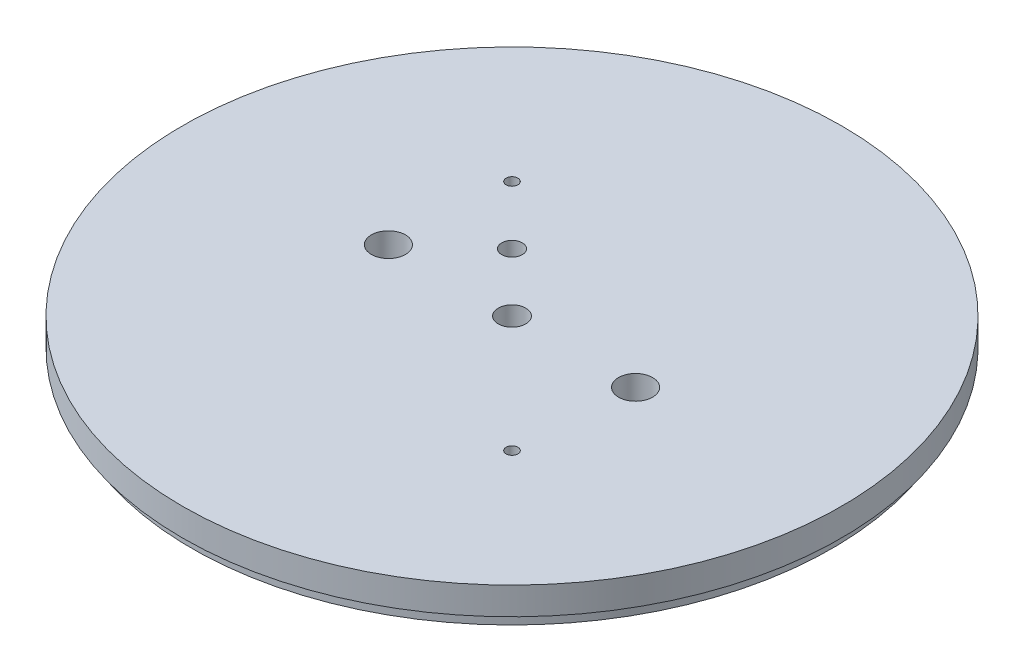
from build123d import *

# Parameters (mm, degrees)
SKETCH1_R           = 76.2
SKETCH1_R_2         = 3.175
SKETCH1_R_3         = 3.937
SKETCH1_R_4         = 1.3589
SKETCH1_R_5         = 2.38125
BOSS_EXTRUDE1_DEPTH = 9.525
SKETCH2_R           = 76.2
SKETCH2_R_2         = 74.041
CUT_EXTRUDE1_DEPTH  = 3.175
CUT_EXTRUDE2_START  = -5.969
CUT_EXTRUDE2_DEPTH  = 3.556


with BuildPart() as part:
    # Sketch1 → Boss-Extrude1 (new body)
    with BuildSketch(Plane(origin=(0, 0, 0), x_dir=(1, 0, 0), z_dir=(0, 1, 0))):
        Circle(SKETCH1_R)
        Circle(SKETCH1_R_2, mode=Mode.SUBTRACT)
        with Locations((28.575, 0)):
            Circle(SKETCH1_R_3, mode=Mode.SUBTRACT)
        with Locations((-28.575, 0)):
            Circle(SKETCH1_R_3, mode=Mode.SUBTRACT)
        with Locations((-26.940768363, 26.940768363)):
            Circle(SKETCH1_R_4, mode=Mode.SUBTRACT)
        with Locations((26.940768363, -26.940768363)):
            Circle(SKETCH1_R_4, mode=Mode.SUBTRACT)
        with Locations((-13.470384182, 13.470384182)):
            Circle(SKETCH1_R_5, mode=Mode.SUBTRACT)
    extrude(amount=BOSS_EXTRUDE1_DEPTH)

    # Sketch2 → Cut-Extrude1 (cut)
    with BuildSketch(Plane.XZ):
        Circle(SKETCH2_R)
        Circle(SKETCH2_R_2, mode=Mode.SUBTRACT)
    extrude(amount=-CUT_EXTRUDE1_DEPTH, mode=Mode.SUBTRACT)

    # Sketch3 → Cut-Extrude2 (cut)
    with BuildSketch(Plane(origin=(0, 9.525, 0), x_dir=(1, 0, 0), z_dir=(0, 1, 0)).offset(CUT_EXTRUDE2_START)):
        with BuildLine():
            Line((3.2385, 34.798), (3.2385, 13.97))
            ThreePointArc((3.2385, 13.97), (0, 10.7315), (-3.2385, 13.97))
            Line((-3.2385, 13.97), (-3.2385, 34.798))
            ThreePointArc((-3.2385, 34.798), (0, 38.0365), (3.2385, 34.798))
        make_face()
        with BuildLine():
            Line((3.2385, -34.798), (3.2385, -13.97))
            ThreePointArc((3.2385, -13.97), (0, -10.7315), (-3.2385, -13.97))
            Line((-3.2385, -13.97), (-3.2385, -34.798))
            ThreePointArc((-3.2385, -34.798), (0, -38.0365), (3.2385, -34.798))
        make_face()
    extrude(amount=-CUT_EXTRUDE2_DEPTH, mode=Mode.SUBTRACT)


solid = part.part
